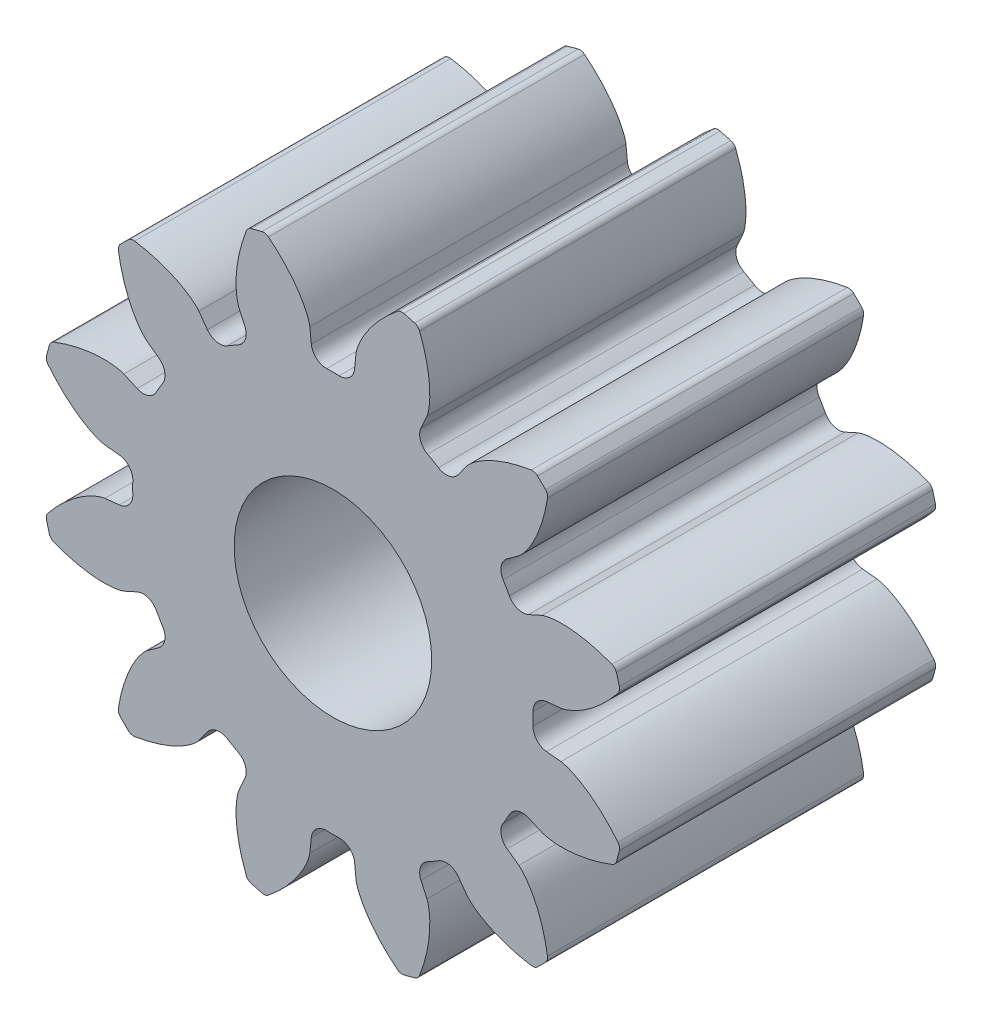
from build123d import *

# Parameters (mm, degrees)
SKETCH1_R                                 = 11.853333333
BOSS_EXTRUDE1_DEPTH                       = 12.7
CUT_EXTRUDE_DCLTBC_DEPTH                  = 22.03076371
FILLET_TIP_DCLTBC_R                       = 0.301120865
FILLET_ROOT_DCLTBC_R                      = 0.602241731
CIRPATTERN_DCLTBC_COUNT                   = 12
FILLET_TIP_DCLTBC_OF_CIRPATTERN_DCLTBC_R  = 0.301120865
FILLET_ROOT_DCLTBC_OF_CIRPATTERN_DCLTBC_R = 0.602241731
SKETCH8_R                                 = 3.96875
CUT_EXTRUDE5_DEPTH                        = 25.4


with BuildPart() as part:
    # Sketch1 → Boss-Extrude1 (new body)
    with BuildSketch(Plane.XY):
        Circle(SKETCH1_R)
    extrude(amount=BOSS_EXTRUDE1_DEPTH)

    # DCLTBC → Cut-Extrude-DCLTBC (cut, through all)
    with BuildSketch(Plane.XY):
        with BuildLine():
            Line((-0.927743365, 9.16123139), (-0.810390806, 8.002404504))
            ThreePointArc((-0.810390806, 8.002404504), (0, 8.043333333), (0.810390806, 8.002404504))
            Line((0.810390806, 8.002404504), (0.927743365, 9.16123139))
            add(Edge.make_bspline(
                [(0.927743365, 9.16123139), (0.928270372, 9.165673983), (0.929984249, 9.178104902), (0.934154408, 9.201482103), (0.942272678, 9.239404048), (0.95453976, 9.287358179), (0.97258884, 9.348853599), (0.99665505, 9.420608876), (1.026018144, 9.498665989), (1.061081726, 9.582644473), (1.098798006, 9.665527918), (1.138943653, 9.747315392), (1.181195241, 9.827946033), (1.235016859, 9.924559354), (1.303210394, 10.038900187), (1.38815898, 10.170192354), (1.490627, 10.316197145), (1.601467698, 10.461683871), (1.715760673, 10.602046337), (1.837096668, 10.740448036), (1.958640091, 10.871922616), (2.090694707, 11.004746474), (2.215561338, 11.125464492), (2.361691224, 11.256359858), (2.481459017, 11.360740357), (2.610240501, 11.464797066), (2.673658985, 11.514879464), (2.706378605, 11.540235091)],
                knots=[0, 0, 0, 0, 0, 0.005376749, 0.015083688, 0.02853182, 0.046610139, 0.064854849, 0.092110525, 0.119476176, 0.146842496, 0.174208854, 0.201574955, 0.228941013, 0.256307345, 0.307035032, 0.361767352, 0.41649966, 0.471231936, 0.525964282, 0.580696615, 0.635428982, 0.690161387, 0.744893688, 0.799626082, 0.854358408, 0.909090915, 0.909090915, 0.909090915, 0.909090915, 0.909090915], degree=4))
            ThreePointArc((2.706378605, 11.540235091), (0, 11.853333333), (-2.706378605, 11.540235091))
            add(Edge.make_bspline(
                [(-0.927743365, 9.16123139), (-0.928270372, 9.165673983), (-0.929984249, 9.178104902), (-0.934154408, 9.201482103), (-0.942272678, 9.239404048), (-0.95453976, 9.287358179), (-0.97258884, 9.348853599), (-0.99665505, 9.420608876), (-1.026018144, 9.498665989), (-1.061081726, 9.582644473), (-1.098798006, 9.665527918), (-1.138943653, 9.747315392), (-1.181195241, 9.827946033), (-1.235016859, 9.924559354), (-1.303210394, 10.038900187), (-1.38815898, 10.170192354), (-1.490627, 10.316197145), (-1.601467698, 10.461683871), (-1.715760673, 10.602046337), (-1.837096668, 10.740448036), (-1.958640091, 10.871922616), (-2.090694707, 11.004746474), (-2.215561338, 11.125464492), (-2.361691224, 11.256359858), (-2.481459017, 11.360740357), (-2.610240501, 11.464797066), (-2.673658985, 11.514879464), (-2.706378605, 11.540235091)],
                knots=[0, 0, 0, 0, 0, 0.005376749, 0.015083688, 0.02853182, 0.046610139, 0.064854849, 0.092110525, 0.119476176, 0.146842496, 0.174208854, 0.201574955, 0.228941013, 0.256307345, 0.307035032, 0.361767352, 0.41649966, 0.471231936, 0.525964282, 0.580696615, 0.635428982, 0.690161387, 0.744893688, 0.799626082, 0.854358408, 0.909090915, 0.909090915, 0.909090915, 0.909090915, 0.909090915], degree=4))
        make_face()
    cut_extrude_dcltbc = extrude(amount=CUT_EXTRUDE_DCLTBC_DEPTH, mode=Mode.SUBTRACT)

    # Fillet-Tip-DCLTBC
    fillet_tip_dcltbc_edges = [part.edges().sort_by_distance(p)[0] for p in [
        (2.706378605, 11.540235091, 6.35),
        (-2.706378605, 11.540235091, 6.35),
    ]]
    fillet(fillet_tip_dcltbc_edges, radius=FILLET_TIP_DCLTBC_R)

    # Fillet-Root-DCLTBC
    fillet_root_dcltbc_edges = [part.edges().sort_by_distance(p)[0] for p in [
        (-0.810390806, 8.002404504, 6.35),
        (0.810390806, 8.002404504, 6.35),
    ]]
    fillet(fillet_root_dcltbc_edges, radius=FILLET_ROOT_DCLTBC_R)

    # CirPattern-DCLTBC: Cut-Extrude-DCLTBC ×12 about axis
    cirpattern_dcltbc_axis = Axis((0, 0, 12.7), (0, 0, 1))
    for i in range(1, CIRPATTERN_DCLTBC_COUNT):
        add(cut_extrude_dcltbc.rotate(cirpattern_dcltbc_axis, i * 360 / CIRPATTERN_DCLTBC_COUNT), mode=Mode.SUBTRACT)

    # Fillet-Tip-DCLTBC of CirPattern-DCLTBC
    fillet_tip_dcltbc_of_cirpattern_dcltbc_edges = [part.edges().sort_by_distance(p)[0] for p in [
        (-3.426324921, 11.347326057, 6.35),
        (-8.11391017, 8.640947452, 6.35),
        (-8.640947452, 8.11391017, 6.35),
        (-11.347326057, 3.426324921, 6.35),
        (-11.540235091, 2.706378605, 6.35),
        (-11.540235091, -2.706378605, 6.35),
        (-11.347326057, -3.426324921, 6.35),
        (-8.640947452, -8.11391017, 6.35),
        (-8.11391017, -8.640947452, 6.35),
        (-3.426324921, -11.347326057, 6.35),
        (-2.706378605, -11.540235091, 6.35),
        (2.706378605, -11.540235091, 6.35),
        (3.426324921, -11.347326057, 6.35),
        (8.11391017, -8.640947452, 6.35),
        (8.640947452, -8.11391017, 6.35),
        (11.347326057, -3.426324921, 6.35),
        (11.540235091, -2.706378605, 6.35),
        (11.540235091, 2.706378605, 6.35),
        (11.347326057, 3.426324921, 6.35),
        (8.640947452, 8.11391017, 6.35),
        (8.11391017, 8.640947452, 6.35),
        (3.426324921, 11.347326057, 6.35),
    ]]
    fillet(fillet_tip_dcltbc_of_cirpattern_dcltbc_edges, radius=FILLET_TIP_DCLTBC_OF_CIRPATTERN_DCLTBC_R)

    # Fillet-Root-DCLTBC of CirPattern-DCLTBC
    fillet_root_dcltbc_of_cirpattern_dcltbc_edges = [part.edges().sort_by_distance(p)[0] for p in [
        (-4.703021277, 6.525090189, 6.35),
        (-3.299383228, 7.335480995, 6.35),
        (-7.335480995, 3.299383228, 6.35),
        (-6.525090189, 4.703021277, 6.35),
        (-8.002404504, -0.810390806, 6.35),
        (-8.002404504, 0.810390806, 6.35),
        (-6.525090189, -4.703021277, 6.35),
        (-7.335480995, -3.299383228, 6.35),
        (-3.299383228, -7.335480995, 6.35),
        (-4.703021277, -6.525090189, 6.35),
        (0.810390806, -8.002404504, 6.35),
        (-0.810390806, -8.002404504, 6.35),
        (4.703021277, -6.525090189, 6.35),
        (3.299383228, -7.335480995, 6.35),
        (7.335480995, -3.299383228, 6.35),
        (6.525090189, -4.703021277, 6.35),
        (8.002404504, 0.810390806, 6.35),
        (8.002404504, -0.810390806, 6.35),
        (6.525090189, 4.703021277, 6.35),
        (7.335480995, 3.299383228, 6.35),
        (3.299383228, 7.335480995, 6.35),
        (4.703021277, 6.525090189, 6.35),
    ]]
    fillet(fillet_root_dcltbc_of_cirpattern_dcltbc_edges, radius=FILLET_ROOT_DCLTBC_OF_CIRPATTERN_DCLTBC_R)

    # Sketch8 → Cut-Extrude5 (cut)
    with BuildSketch(Plane.XY):
        Circle(SKETCH8_R)
    extrude(amount=CUT_EXTRUDE5_DEPTH, mode=Mode.SUBTRACT)


solid = part.part
